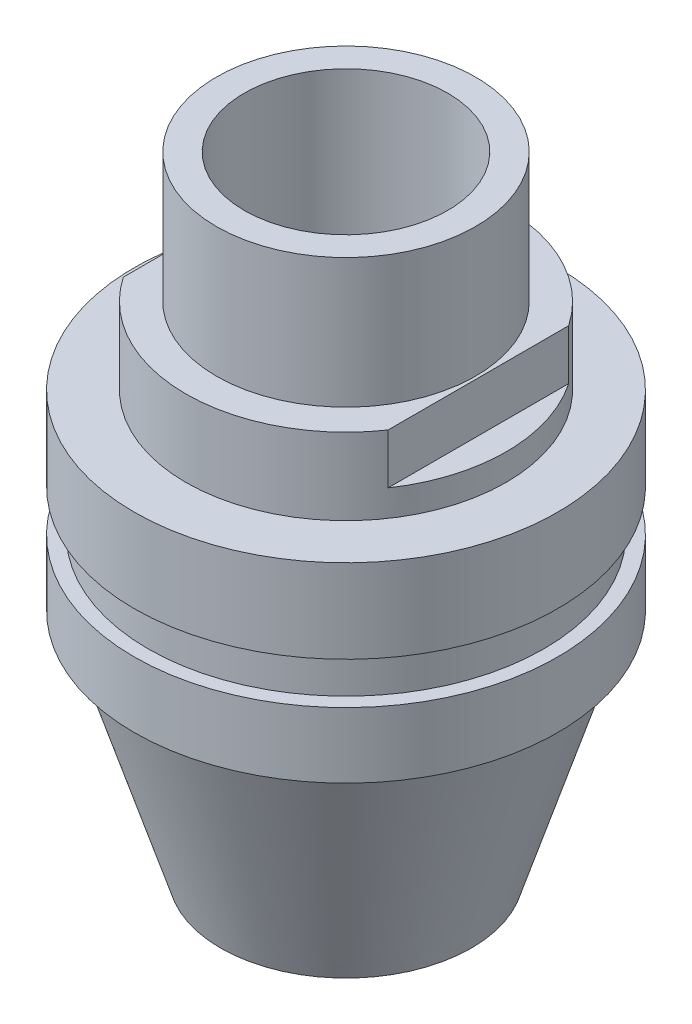
from build123d import *

# Parameters (mm, degrees)
CUT_EXTRUDE1_DEPTH   = 1.8
SHELL1_START         = -21.5
SHELL1_OUTLINE_R     = 3.65
SHELL1_DEPTH         = 21.5
SHELL1_START_2       = -13.25
SHELL1_2_OUTLINE_R   = 6.1
SHELL1_2_OUTLINE_R_2 = 3.65
SHELL1_2_DEPTH       = 4.85
SHELL1_START_3       = -8.4
SHELL1_3_OUTLINE_R   = 3.65
SHELL1_3_DEPTH       = 2.75
SHELL1_START_4       = -9.4
SHELL1_4_OUTLINE_R   = 6.6
SHELL1_4_OUTLINE_R_2 = 6.1
SHELL1_4_DEPTH       = 1
SHELL1_5_DEPTH       = 0.95
SHELL1_6_OUTLINE_R   = 6.6
SHELL1_6_OUTLINE_R_2 = 6.1
SHELL1_6_DEPTH       = 0.35
SKETCH3_R            = 3.766666667
CUT_EXTRUDE2_DEPTH   = 6.8


with BuildPart() as part:
    # Sketch1 → Revolve1 (revolve)
    with BuildSketch(Plane.XY, mode=Mode.PRIVATE) as revolve1_sk:
        Polygon((0, 0), (0, -22.5), (4.5, -22.5), (7.1, -14.25), (7.6, -14.25), (7.6, -11.9), (7.1, -11.9), (7.1, -10.4), (7.6, -10.4), (7.6, -7.4), (5.75, -7.4), (5.75, -4.65), (4.65, -4.65), (4.65, 0), align=None)
    revolve(revolve1_sk.sketch.rotate(Axis((0, 0, 0), (0, -1, 0)), 90), axis=Axis((0, 0, 0), (0, -1, 0)))

    # Sketch2 → Cut-Extrude1 (cut)
    with BuildSketch(Plane(origin=(0, -4.65, 0), x_dir=(1, 0, 0), z_dir=(0, 1, 0))):
        with BuildLine():
            Line((-4.75, -3.240370349), (-4.75, 3.240370349))
            ThreePointArc((-4.75, 3.240370349), (-5.75, 0), (-4.75, -3.240370349))
        make_face()
        with BuildLine():
            ThreePointArc((5.75, 0), (5.494315244, 1.695582496), (4.75, 3.240370349))
            Line((4.75, 3.240370349), (4.75, -3.240370349))
            ThreePointArc((4.75, -3.240370349), (5.494315244, -1.695582496), (5.75, 0))
        make_face()
    extrude(amount=-CUT_EXTRUDE1_DEPTH, mode=Mode.SUBTRACT)

    # Shell1: read off the stored shape, not the designer's step
    # Shell1 outline → Shell1 (cut)
    with BuildSketch(Plane(origin=(0, 0, 0), x_dir=(1, 0, 0), z_dir=(0, 1, 0)).offset(SHELL1_START)):
        Circle(SHELL1_OUTLINE_R)
    extrude(amount=SHELL1_DEPTH, mode=Mode.SUBTRACT)

    # Shell1 2 outline → Shell1 2 (cut)
    with BuildSketch(Plane(origin=(0, 0, 0), x_dir=(1, 0, 0), z_dir=(0, 1, 0)).offset(SHELL1_START_2)):
        Circle(SHELL1_2_OUTLINE_R)
        Circle(SHELL1_2_OUTLINE_R_2, mode=Mode.SUBTRACT)
    extrude(amount=SHELL1_2_DEPTH, mode=Mode.SUBTRACT)

    # Shell1 3 outline → Shell1 3 (cut)
    with BuildSketch(Plane(origin=(0, 0, 0), x_dir=(1, 0, 0), z_dir=(0, 1, 0)).offset(SHELL1_START_3)):
        with BuildLine():
            Line((3.75, -2.915475947), (3.75, 2.915475947))
            ThreePointArc((3.75, 2.915475947), (0, 4.75), (-3.75, 2.915475947))
            Line((-3.75, 2.915475947), (-3.75, -2.915475947))
            ThreePointArc((-3.75, -2.915475947), (0, -4.75), (3.75, -2.915475947))
        make_face()
        Circle(SHELL1_3_OUTLINE_R, mode=Mode.SUBTRACT)
    extrude(amount=SHELL1_3_DEPTH, mode=Mode.SUBTRACT)

    # Shell1 4 outline → Shell1 4 (cut)
    with BuildSketch(Plane(origin=(0, 0, 0), x_dir=(1, 0, 0), z_dir=(0, 1, 0)).offset(SHELL1_START_4)):
        Circle(SHELL1_4_OUTLINE_R)
        Circle(SHELL1_4_OUTLINE_R_2, mode=Mode.SUBTRACT)
    extrude(amount=SHELL1_4_DEPTH, mode=Mode.SUBTRACT)

    # Shell1 5 outline → Shell1 5 (cut)
    with BuildSketch(Plane(origin=(0, 0, 0), x_dir=(1, 0, 0), z_dir=(0, 1, 0)).offset(SHELL1_START_3)):
        with BuildLine():
            ThreePointArc((3.75, -2.915475947), (4.75, 0), (3.75, 2.915475947))
            Line((3.75, 2.915475947), (3.75, -2.915475947))
        make_face()
        with BuildLine():
            Line((-3.75, -2.915475947), (-3.75, 2.915475947))
            ThreePointArc((-3.75, 2.915475947), (-4.75, 0), (-3.75, -2.915475947))
        make_face()
    extrude(amount=SHELL1_5_DEPTH, mode=Mode.SUBTRACT)

    # Shell1 6 outline → Shell1 6 (cut)
    with BuildSketch(Plane(origin=(0, 0, 0), x_dir=(1, 0, 0), z_dir=(0, 1, 0)).offset(SHELL1_START_2)):
        Circle(SHELL1_6_OUTLINE_R)
        Circle(SHELL1_6_OUTLINE_R_2, mode=Mode.SUBTRACT)
    extrude(amount=SHELL1_6_DEPTH, mode=Mode.SUBTRACT)

    # Shell1 7 outline → Shell1 7 (revolve, cut)
    with BuildSketch(Plane.XY):
        Polygon((6.366666667, -13.25), (3.65, -13.25), (3.65, -21.5), (3.766666667, -21.5), align=None)
    revolve(axis=Axis((0, 0, 0), (0, 1, 0)), mode=Mode.SUBTRACT)

    # Sketch3 → Cut-Extrude2 (cut)
    with BuildSketch(Plane(origin=(0, -21.5, 0), x_dir=(1, 0, 0), z_dir=(0, 1, 0))):
        with Locations(Location((0, 0, 0), (0, 0, 270))):
            Circle(SKETCH3_R)
    extrude(amount=-CUT_EXTRUDE2_DEPTH, mode=Mode.SUBTRACT)


solid = part.part
